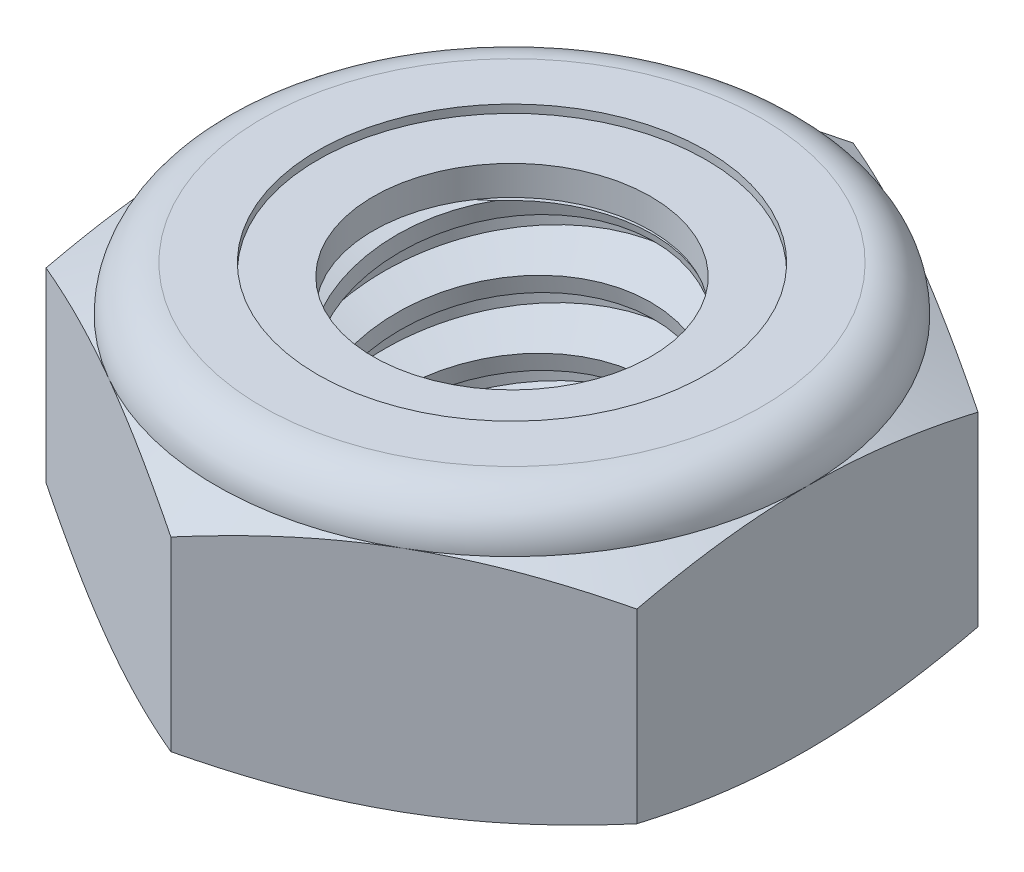
from build123d import *

# Parameters (mm, degrees)
EXTRUDE1_DEPTH       = 5.159375
SKETCH2_W            = 3.175
SKETCH2_H            = 5.159375
LPATTERN1_COUNT      = 4
LPATTERN1_PITCH      = 1.27
LPATTERN1_COUNT_DIR2 = 2
LPATTERN1_PITCH_DIR2 = 1.27


with BuildPart() as part:
    # Sketch1 → Extrude1 (new body)
    with BuildSketch(Plane(origin=(0, 0, 0), x_dir=(1, 0, 0), z_dir=(0, 1, 0))):
        Polygon((0, 6.415804866), (-5.55625, 3.207902433), (-5.55625, -3.207902433), (0, -6.415804866), (5.55625, -3.207902433), (5.55625, 3.207902433), align=None)
    extrude(amount=EXTRUDE1_DEPTH)

    # Sketch4 → Cut-Revolve2 (revolve, cut)
    with BuildSketch(Plane(origin=(0, 0, 0), x_dir=(0, 0, -1), z_dir=(1, 0, 0))):
        Polygon((0, 5.159375), (3.175, 5.159375), (2.609908356, 4.895868439), (2.609908356, 0.263506561), (3.175, 0), (0, 0), align=None)
    revolve(axis=Axis((0, 5.159375, 0), (0, 1, 0)), mode=Mode.SUBTRACT)


with BuildPart() as body_2:
    # Sketch2 → Revolve1 (revolve)
    with BuildSketch(Plane(origin=(0, 0, 0), x_dir=(0, 0, -1), z_dir=(1, 0, 0))):
        with Locations((1.5875, 2.5796875)):
            Rectangle(SKETCH2_W, SKETCH2_H)
    revolve(axis=Axis((0, -3.175, 0), (0, 1, 0)))

    # Sketch3 → Cut-Revolve1 (revolve, cut)
    with BuildSketch(Plane(origin=(0, 0, 0), x_dir=(0, 0, -1), z_dir=(1, 0, 0))):
        Polygon((3.206133436, 5.003707818), (3.424067492, 3.914037542), (2.672175229, 4.168393763), (2.609908356, 4.479728128), align=None)
    cut_revolve1 = revolve(axis=Axis((0, 5.159375, 0.272704483), (0, -0.9805806756909202, -0.19611613513818413)), mode=Mode.SUBTRACT)

    # LPattern1: Cut-Revolve1 4 × 2
    with Locations(*[Vector(0, -1, 0) * (i * LPATTERN1_PITCH) + Vector(0, 1, 0) * (j * LPATTERN1_PITCH_DIR2) for i in range(LPATTERN1_COUNT) for j in range(LPATTERN1_COUNT_DIR2) if (i, j) != (0, 0)]):
        add(cut_revolve1, mode=Mode.SUBTRACT)


with BuildPart() as part_1:
    add(part.part)

    # Combine1: cut body 2
    add(body_2.part, mode=Mode.SUBTRACT)

    # Sketch5 → Cut-Revolve3 (revolve, cut)
    with BuildSketch(Plane(origin=(0, 0, 0), x_dir=(0, 0, -1), z_dir=(1, 0, 0))):
        with BuildLine():
            Line((0, 0), (5.55625, 0))
            Line((5.55625, 0), (6.415804866, 0.400817017))
            Line((6.415804866, 0.400817017), (6.415804866, 3.89866215))
            Line((6.415804866, 3.89866215), (5.55625, 4.299479167))
            ThreePointArc((5.55625, 4.299479167), (5.304392342, 4.907517342), (4.696354167, 5.159375))
            Line((4.696354167, 5.159375), (4.696354167, 6.429375))
            Line((4.696354167, 6.429375), (7.685804866, 6.429375))
            Line((7.685804866, 6.429375), (7.685804866, -1.27))
            Line((7.685804866, -1.27), (0, -1.27))
            Line((0, -1.27), (0, 0))
        make_face()
    revolve(axis=Axis((0, 0, 0), (0, 1, 0)), mode=Mode.SUBTRACT)

    # Sketch6 → Cut-Revolve4 (revolve, cut)
    with BuildSketch(Plane(origin=(0, 0, 0), x_dir=(0, 0, -1), z_dir=(1, 0, 0))):
        with BuildLine():
            Line((0, 4.299479167), (5.40385, 4.299479167))
            ThreePointArc((5.40385, 4.299479167), (5.196629268, 4.799754268), (4.696354167, 5.006975))
            Line((4.696354167, 5.006975), (3.653131261, 5.006975))
            Line((3.653131261, 5.006975), (3.653131261, 6.429375))
            Line((3.653131261, 6.429375), (0, 6.429375))
            Line((0, 6.429375), (0, 4.299479167))
        make_face()
    revolve(axis=Axis((0, 6.429375, 0), (0, 1, 0)), mode=Mode.SUBTRACT)


with BuildPart() as body_2_2:
    # Sketch7 → Revolve2 (revolve)
    with BuildSketch(Plane(origin=(0, 0, 0), x_dir=(0, 0, -1), z_dir=(1, 0, 0))):
        with BuildLine():
            Line((2.609908356, 4.375679167), (5.3230343, 4.375679167))
            ThreePointArc((5.3230343, 4.375679167), (5.114940888, 4.772046184), (4.696354167, 4.930775))
            Line((4.696354167, 4.930775), (2.609908356, 4.930775))
            Line((2.609908356, 4.930775), (2.609908356, 4.375679167))
        make_face()
    revolve(axis=Axis((0, 4.375679167, 0), (0, 1, 0)))


solid = Compound([part_1.part, body_2_2.part])
